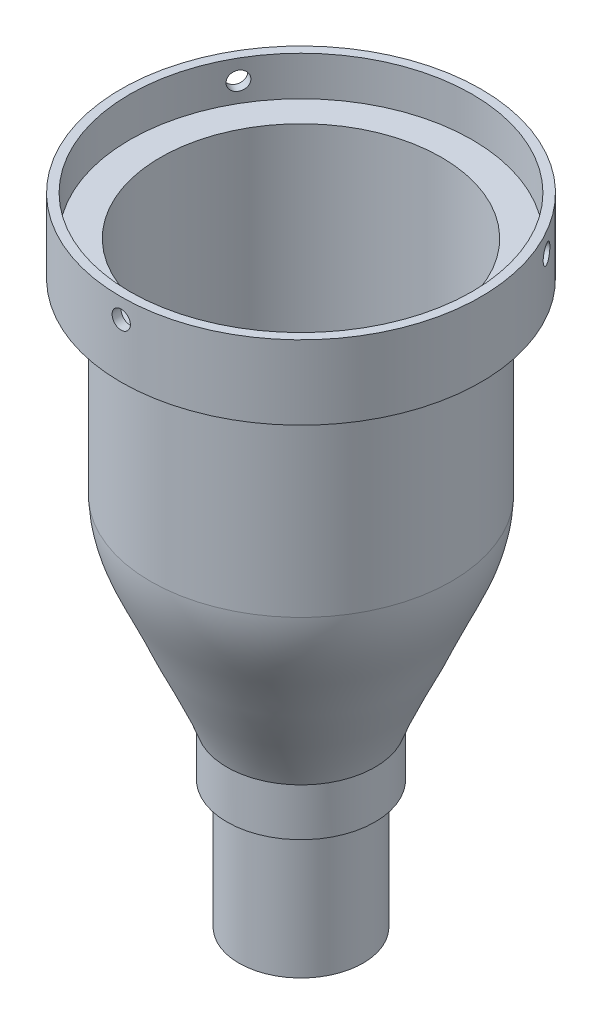
from build123d import *

# Parameters (mm, degrees)
SKETCH1_R           = 12.6
SKETCH1_R_2         = 11.1
BOSS_EXTRUDE1_DEPTH = 26
SKETCH2_R           = 30.5
SKETCH2_R_2         = 28.5
BOSS_EXTRUDE2_DEPTH = 45
SKETCH7_R           = 36.5
SKETCH7_R_2         = 30.5
BOSS_EXTRUDE3_DEPTH = 7
BOSS_EXTRUDE4_REACH = 110.118
SKETCH8_R           = 15.011589035
SKETCH8_R_2         = 12.6
SKETCH7_3_R         = 36.5
SKETCH7_3_R_2       = 34.7
BOSS_EXTRUDE5_DEPTH = 8
SKETCH14_R          = 1.85
CUT_EXTRUDE1_DEPTH  = 8
CIRPATTERN1_COUNT   = 3


with BuildPart() as part:
    # Sketch1 → Boss-Extrude1 (new body)
    with BuildSketch(Plane(origin=(0, 0, 0), x_dir=(1, 0, 0), z_dir=(0, 1, 0))):
        Circle(SKETCH1_R)
        Circle(SKETCH1_R_2, mode=Mode.SUBTRACT)
    extrude(amount=-BOSS_EXTRUDE1_DEPTH)



with BuildPart() as body_2:
    # Sketch2 → Boss-Extrude2 (new body)
    with BuildSketch(Plane(origin=(0, 50, 0), x_dir=(1, 0, 0), z_dir=(0, 1, 0))):
        Circle(SKETCH2_R)
        Circle(SKETCH2_R_2, mode=Mode.SUBTRACT)
    extrude(amount=BOSS_EXTRUDE2_DEPTH)


with BuildPart() as part_1:
    add(part.part)

    add(body_2.part)  # Revolve2 merges body 2
    # Sketch6 → Revolve2 (revolve)
    with BuildSketch(Plane(origin=(0, 0, 0), x_dir=(0, 0, -1), z_dir=(1, 0, 0))):
        with BuildLine():
            Line((11.1, 0), (12.6, 0))
            add(Edge.make_bspline(
                [(12.6, 0), (14.219035257, 10.406719414), (19.248328345, 18.862718749), (26.086671293, 35.475812234), (30.18641801, 42.333036244), (30.5, 50)],
                knots=[0, 0, 0, 0, 0.476692395, 0.576692395, 1, 1, 1, 1], degree=3))
            Line((30.5, 50), (28.5, 50))
            add(Edge.make_bspline(
                [(11.1, 0), (11.515632478, 8.462663343), (16.341384341, 17.420081245), (23.859648418, 35.028645214), (27.060149287, 41.703867791), (28.5, 50)],
                knots=[0, 0, 0, 0, 0.530323892, 0.630323892, 1, 1, 1, 1], degree=3))
        make_face()
    revolve(axis=Axis((0, 0, 0), (0, 1, 0)))

    # Sketch8 → Boss-Extrude4 (add, up to next)
    with BuildSketch(Plane(origin=(0, 0, 0), x_dir=(1, 0, 0), z_dir=(0, 1, 0)), mode=Mode.PRIVATE) as boss_extrude4_sk1:
        Circle(SKETCH8_R)
        Circle(SKETCH8_R_2, mode=Mode.SUBTRACT)
    boss_extrude4_tool1 = extrude(boss_extrude4_sk1.sketch, amount=BOSS_EXTRUDE4_REACH, mode=Mode.PRIVATE) - part_1.part
    add(boss_extrude4_tool1.solids().sort_by_distance((-14.586997, 0, 0))[0])


with BuildPart() as body_2_2:
    # Sketch7 → Boss-Extrude3 (new body)
    with BuildSketch(Plane(origin=(0, 95, 0), x_dir=(1, 0, 0), z_dir=(0, 1, 0))):
        Circle(SKETCH7_R)
        Circle(SKETCH7_R_2, mode=Mode.SUBTRACT)
    extrude(amount=-BOSS_EXTRUDE3_DEPTH)


    add(part_1.part)  # Boss-Extrude5 merges part
    # Sketch7<3> → Boss-Extrude5 (add)
    with BuildSketch(Plane(origin=(0, 95, 0), x_dir=(1, 0, 0), z_dir=(0, 1, 0))):
        Circle(SKETCH7_3_R)
        Circle(SKETCH7_3_R_2, mode=Mode.SUBTRACT)
    extrude(amount=BOSS_EXTRUDE5_DEPTH)

    # Sketch14 → Cut-Extrude1 (cut)
    with BuildSketch(Plane.XY.offset(36.5)):
        with Locations((0, 99)):
            Circle(SKETCH14_R)
    cut_extrude1 = extrude(amount=-CUT_EXTRUDE1_DEPTH, mode=Mode.SUBTRACT)

    # CirPattern1: Cut-Extrude1 ×3 about axis
    cirpattern1_axis = Axis((0, 103, 0), (0, 1, 0))
    for i in range(1, CIRPATTERN1_COUNT):
        add(cut_extrude1.rotate(cirpattern1_axis, i * 360 / CIRPATTERN1_COUNT), mode=Mode.SUBTRACT)


solid = body_2_2.part
